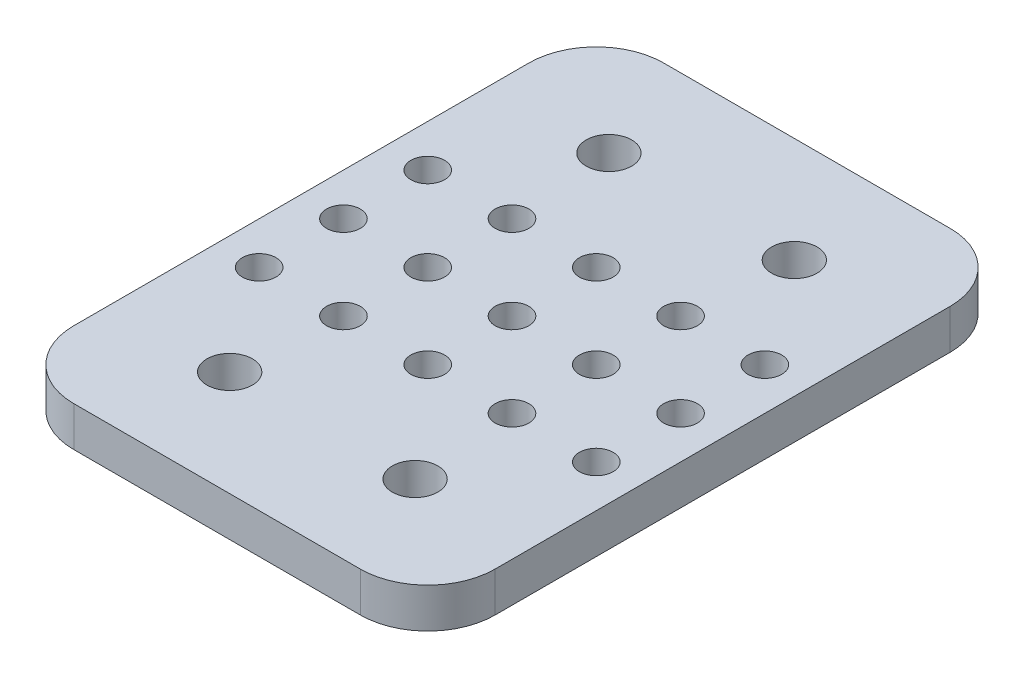
from build123d import *

# Parameters (mm, degrees)
SKETCH1_W           = 63.5
SKETCH1_H           = 88.9
SKETCH1_R           = 3.429
BOSS_EXTRUDE1_DEPTH = 6
FILLET1_R           = 10.16
SKETCH2_R           = 2.54
CUT_EXTRUDE1_DEPTH  = 110.414167273


with BuildPart() as part:
    # Sketch1 → Boss-Extrude1 (new body)
    with BuildSketch(Plane(origin=(0, 0, 0), x_dir=(1, 0, 0), z_dir=(0, 1, 0))):
        with Locations((31.75, 44.45)):
            Rectangle(SKETCH1_W, SKETCH1_H)
        with Locations((17.78, 73.025)):
            Circle(SKETCH1_R, mode=Mode.SUBTRACT)
        with Locations((45.72, 15.875)):
            Circle(SKETCH1_R, mode=Mode.SUBTRACT)
        with Locations((17.78, 15.875)):
            Circle(SKETCH1_R, mode=Mode.SUBTRACT)
        with Locations((45.72, 73.025)):
            Circle(SKETCH1_R, mode=Mode.SUBTRACT)
    extrude(amount=BOSS_EXTRUDE1_DEPTH)

    # Fillet1
    fillet1_edges = [part.edges().sort_by_distance(p)[0] for p in [
        (0, 3, -88.9),
        (63.5, 3, -88.9),
        (63.5, 3, 0),
        (0, 3, 0),
    ]]
    fillet(fillet1_edges, radius=FILLET1_R)

    # Sketch2 → Cut-Extrude1 (cut, through all)
    with BuildSketch(Plane(origin=(0, 6, 0), x_dir=(1, 0, 0), z_dir=(0, 1, 0))):
        with Locations((6.35, 57.15)):
            Circle(SKETCH2_R)
        with Locations((6.35, 44.45)):
            Circle(SKETCH2_R)
        with Locations((6.35, 31.75)):
            Circle(SKETCH2_R)
        with Locations((19.05, 31.75)):
            Circle(SKETCH2_R)
        with Locations((19.05, 44.45)):
            Circle(SKETCH2_R)
        with Locations((19.05, 57.15)):
            Circle(SKETCH2_R)
        with Locations((31.75, 31.75)):
            Circle(SKETCH2_R)
        with Locations((31.75, 44.45)):
            Circle(SKETCH2_R)
        with Locations((31.75, 57.15)):
            Circle(SKETCH2_R)
        with Locations((44.45, 31.75)):
            Circle(SKETCH2_R)
        with Locations((44.45, 44.45)):
            Circle(SKETCH2_R)
        with Locations((44.45, 57.15)):
            Circle(SKETCH2_R)
        with Locations((57.15, 31.75)):
            Circle(SKETCH2_R)
        with Locations((57.15, 44.45)):
            Circle(SKETCH2_R)
        with Locations((57.15, 57.15)):
            Circle(SKETCH2_R)
    extrude(amount=-CUT_EXTRUDE1_DEPTH, mode=Mode.SUBTRACT)


solid = part.part
